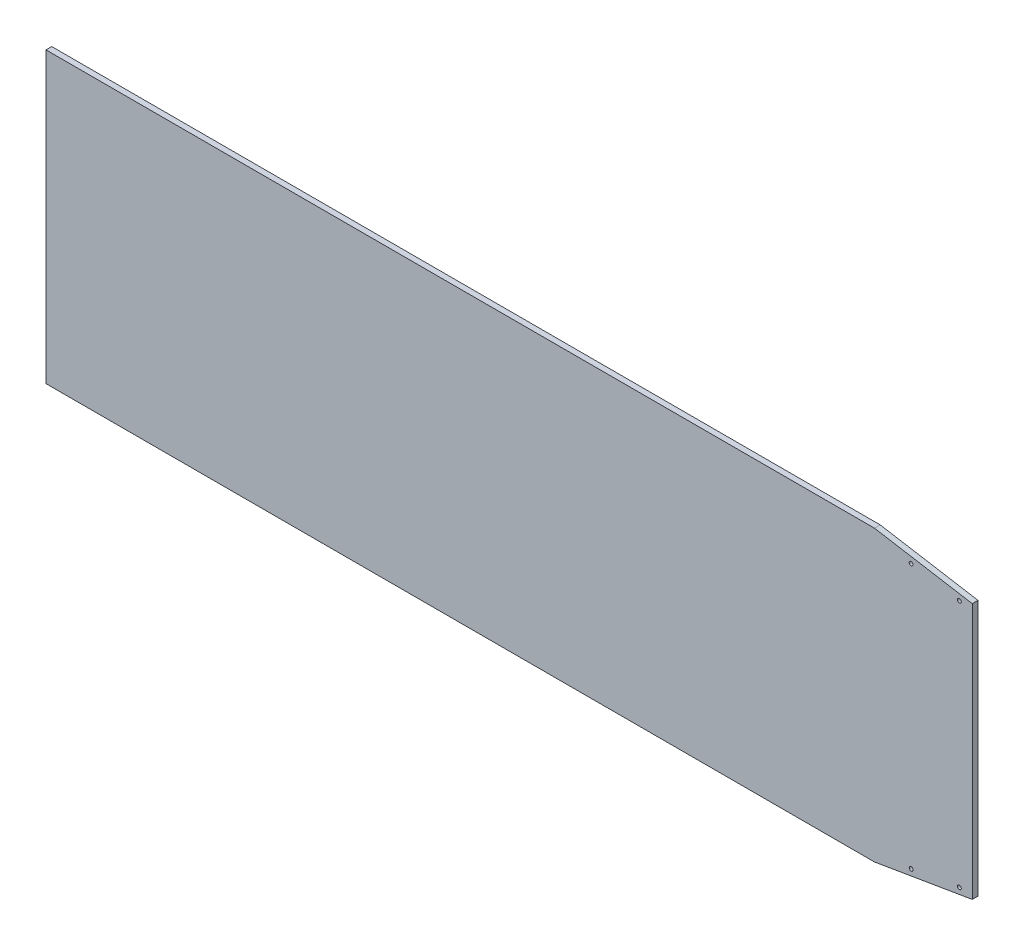
from build123d import *

# Parameters (mm, degrees)
BOSS_EXTRUDE1_DEPTH            = 11.90625
F_5_16_0_3125_DIAMETER_HOLE1_D = 7.9375


with BuildPart() as part:
    # Sketch1 → Boss-Extrude1 (new body)
    with BuildSketch(Plane.XY):
        Polygon((-790.361681544, 230.888219757), (930.488318456, 230.888219757), (1133.688318456, 196.715698242), (1133.688318456, -335.414301758), (930.488318456, -369.586823273), (-790.361681544, -369.586823273), align=None)
    extrude(amount=BOSS_EXTRUDE1_DEPTH)

    # 5/16 (0.3125) Diameter Hole1 (through all)
    with Locations(Plane.XY.offset(11.90625)):
        with Locations((1006.688318456, -343.893790573), (1106.881378068, -327.044137594), (1006.688318456, 205.195187057), (1106.881378068, 188.345534078)):
            Hole(F_5_16_0_3125_DIAMETER_HOLE1_D / 2)


solid = part.part
